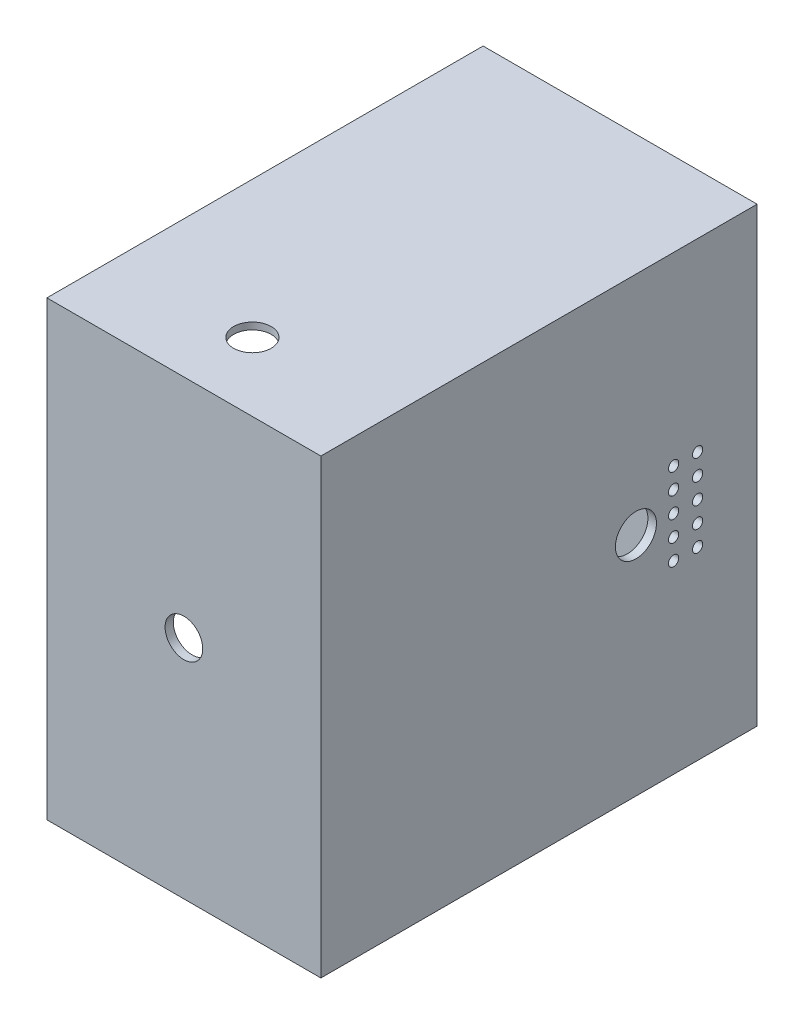
from build123d import *

# Parameters (mm, degrees)
S_BOX1_W        = 80
S_BOX1_H        = 132
BOSS_1_DEPTH    = 127.375
S_CYL2_R        = 3
BOSS_2_DEPTH    = 7.5
S_CYL3_R        = 3
BOSS_3_DEPTH    = 7.5
S_CYL4_R        = 3
BOSS_4_DEPTH    = 7.5
S_CYL5_R        = 3
BOSS_5_DEPTH    = 7.5
S_BOX6_W        = 27.6
S_BOX6_H        = 20.5
BOSS_6_DEPTH    = 17
S_BOX7_W        = 27.6
S_BOX7_H        = 20.5
BOSS_7_DEPTH    = 17
S_BOX8_W        = 27.6
S_BOX8_H        = 17
BOSS_8_DEPTH    = 22.5
S_CUT9_W        = 78.5
S_CUT9_H        = 127
POCKET_9_DEPTH  = 122.375
S_HOLE10_R      = 1.6
HOLE_10_DEPTH   = 2.7
S_HOLE11_R      = 1.6
HOLE_11_DEPTH   = 2.7
S_HOLE12_R      = 1.6
HOLE_12_DEPTH   = 2.7
S_HOLE13_R      = 1.6
HOLE_13_DEPTH   = 2.7
S_HOLE14_R      = 1.5
HOLE_14_DEPTH   = 2.7
S_HOLE15_R      = 1.5
HOLE_15_DEPTH   = 2.7
S_HOLE16_R      = 1.5
HOLE_16_DEPTH   = 2.7
S_HOLE17_R      = 1.5
HOLE_17_DEPTH   = 2.7
S_HOLE18_R      = 1.5
HOLE_18_DEPTH   = 2.7
S_HOLE19_R      = 1.5
HOLE_19_DEPTH   = 2.7
S_HOLE20_R      = 1.5
HOLE_20_DEPTH   = 2.7
S_HOLE21_R      = 1.5
HOLE_21_DEPTH   = 2.7
S_HOLE22_R      = 1.5
HOLE_22_DEPTH   = 2.7
S_HOLE23_R      = 1.5
HOLE_23_DEPTH   = 2.7
S_HOLE24_R      = 6
HOLE_24_DEPTH   = 2.7
S_HOLE25_R      = 1.1
HOLE_25_DEPTH   = 7.7
S_HOLE26_R      = 1.1
HOLE_26_DEPTH   = 7.7
S_HOLE27_R      = 1.1
HOLE_27_DEPTH   = 7.7
S_HOLE28_R      = 1.1
HOLE_28_DEPTH   = 7.7
S_CUT29_W       = 23.6
S_CUT29_H       = 20.6
POCKET_29_DEPTH = 13
S_HOLE30_R      = 5.5
HOLE_30_DEPTH   = 2.7
S_CUT31_W       = 23.6
S_CUT31_H       = 20.6
POCKET_31_DEPTH = 13
S_HOLE32_R      = 5.5
HOLE_32_DEPTH   = 2.7
S_CUT33_W       = 23.6
S_CUT33_H       = 13
POCKET_33_DEPTH = 22.2
S_HOLE34_R      = 5.5
HOLE_34_DEPTH   = 2.7


with BuildPart() as part:
    # S_box1 → Boss_1 (new body)
    with BuildSketch(Plane.XY.offset(68.625)):
        Rectangle(S_BOX1_W, S_BOX1_H)
    extrude(amount=BOSS_1_DEPTH)

    # S_cyl2 → Boss_2 (add)
    with BuildSketch(Plane(origin=(30.5, 0, 0), x_dir=(0, 0, -1), z_dir=(1, 0, 0))):
        with Locations((-115.5, -29)):
            Circle(S_CYL2_R)
    extrude(amount=BOSS_2_DEPTH)

    # S_cyl3 → Boss_3 (add)
    with BuildSketch(Plane(origin=(30.5, 0, 0), x_dir=(0, 0, -1), z_dir=(1, 0, 0))):
        with Locations((-164.5, -29)):
            Circle(S_CYL3_R)
    extrude(amount=BOSS_3_DEPTH)

    # S_cyl4 → Boss_4 (add)
    with BuildSketch(Plane(origin=(30.5, 0, 0), x_dir=(0, 0, -1), z_dir=(1, 0, 0))):
        with Locations((-115.5, 29)):
            Circle(S_CYL4_R)
    extrude(amount=BOSS_4_DEPTH)

    # S_cyl5 → Boss_5 (add)
    with BuildSketch(Plane(origin=(30.5, 0, 0), x_dir=(0, 0, -1), z_dir=(1, 0, 0))):
        with Locations((-164.5, 29)):
            Circle(S_CYL5_R)
    extrude(amount=BOSS_5_DEPTH)

    # S_box6 → Boss_6 (add)
    with BuildSketch(Plane.XY.offset(167.5)):
        with Locations((5.6, 53.75)):
            Rectangle(S_BOX6_W, S_BOX6_H)
    extrude(amount=BOSS_6_DEPTH)

    # S_box7 → Boss_7 (add)
    with BuildSketch(Plane.XY.offset(167.5)):
        with Locations((5.6, -53.75)):
            Rectangle(S_BOX7_W, S_BOX7_H)
    extrude(amount=BOSS_7_DEPTH)

    # S_box8 → Boss_8 (add)
    with BuildSketch(Plane.XY.offset(171.5)):
        with Locations((-5.6, 0)):
            Rectangle(S_BOX8_W, S_BOX8_H)
    extrude(amount=BOSS_8_DEPTH)

    # S_cut9 → Pocket_9 (cut)
    with BuildSketch(Plane.XY.offset(71.125)):
        with Locations((-1.75, 0)):
            Rectangle(S_CUT9_W, S_CUT9_H)
    extrude(amount=POCKET_9_DEPTH, mode=Mode.SUBTRACT)

    # S_hole10 → Hole_10 (cut)
    with BuildSketch(Plane.XY.offset(68.525)):
        with Locations((0, -25)):
            Circle(S_HOLE10_R)
    extrude(amount=HOLE_10_DEPTH, mode=Mode.SUBTRACT)

    # S_hole11 → Hole_11 (cut)
    with BuildSketch(Plane.XY.offset(68.525)):
        with Locations((0, 25)):
            Circle(S_HOLE11_R)
    extrude(amount=HOLE_11_DEPTH, mode=Mode.SUBTRACT)

    # S_hole12 → Hole_12 (cut)
    with BuildSketch(Plane.XY.offset(68.525)):
        with Locations((28, -25)):
            Circle(S_HOLE12_R)
    extrude(amount=HOLE_12_DEPTH, mode=Mode.SUBTRACT)

    # S_hole13 → Hole_13 (cut)
    with BuildSketch(Plane.XY.offset(68.525)):
        with Locations((28, 25)):
            Circle(S_HOLE13_R)
    extrude(amount=HOLE_13_DEPTH, mode=Mode.SUBTRACT)

    # S_hole14 → Hole_14 (cut)
    with BuildSketch(Plane(origin=(37.4, 0, 0), x_dir=(0, 0, -1), z_dir=(1, 0, 0))):
        with Locations((-86, -12)):
            Circle(S_HOLE14_R)
    extrude(amount=HOLE_14_DEPTH, mode=Mode.SUBTRACT)

    # S_hole15 → Hole_15 (cut)
    with BuildSketch(Plane(origin=(37.4, 0, 0), x_dir=(0, 0, -1), z_dir=(1, 0, 0))):
        with Locations((-93, -12)):
            Circle(S_HOLE15_R)
    extrude(amount=HOLE_15_DEPTH, mode=Mode.SUBTRACT)

    # S_hole16 → Hole_16 (cut)
    with BuildSketch(Plane(origin=(37.4, 0, 0), x_dir=(0, 0, -1), z_dir=(1, 0, 0))):
        with Locations((-86, -6)):
            Circle(S_HOLE16_R)
    extrude(amount=HOLE_16_DEPTH, mode=Mode.SUBTRACT)

    # S_hole17 → Hole_17 (cut)
    with BuildSketch(Plane(origin=(37.4, 0, 0), x_dir=(0, 0, -1), z_dir=(1, 0, 0))):
        with Locations((-93, -6)):
            Circle(S_HOLE17_R)
    extrude(amount=HOLE_17_DEPTH, mode=Mode.SUBTRACT)

    # S_hole18 → Hole_18 (cut)
    with BuildSketch(Plane(origin=(37.4, 0, 0), x_dir=(0, 0, -1), z_dir=(1, 0, 0))):
        with Locations((-86, 0)):
            Circle(S_HOLE18_R)
    extrude(amount=HOLE_18_DEPTH, mode=Mode.SUBTRACT)

    # S_hole19 → Hole_19 (cut)
    with BuildSketch(Plane(origin=(37.4, 0, 0), x_dir=(0, 0, -1), z_dir=(1, 0, 0))):
        with Locations((-93, 0)):
            Circle(S_HOLE19_R)
    extrude(amount=HOLE_19_DEPTH, mode=Mode.SUBTRACT)

    # S_hole20 → Hole_20 (cut)
    with BuildSketch(Plane(origin=(37.4, 0, 0), x_dir=(0, 0, -1), z_dir=(1, 0, 0))):
        with Locations((-86, 6)):
            Circle(S_HOLE20_R)
    extrude(amount=HOLE_20_DEPTH, mode=Mode.SUBTRACT)

    # S_hole21 → Hole_21 (cut)
    with BuildSketch(Plane(origin=(37.4, 0, 0), x_dir=(0, 0, -1), z_dir=(1, 0, 0))):
        with Locations((-93, 6)):
            Circle(S_HOLE21_R)
    extrude(amount=HOLE_21_DEPTH, mode=Mode.SUBTRACT)

    # S_hole22 → Hole_22 (cut)
    with BuildSketch(Plane(origin=(37.4, 0, 0), x_dir=(0, 0, -1), z_dir=(1, 0, 0))):
        with Locations((-86, 12)):
            Circle(S_HOLE22_R)
    extrude(amount=HOLE_22_DEPTH, mode=Mode.SUBTRACT)

    # S_hole23 → Hole_23 (cut)
    with BuildSketch(Plane(origin=(37.4, 0, 0), x_dir=(0, 0, -1), z_dir=(1, 0, 0))):
        with Locations((-93, 12)):
            Circle(S_HOLE23_R)
    extrude(amount=HOLE_23_DEPTH, mode=Mode.SUBTRACT)

    # S_hole24 → Hole_24 (cut)
    with BuildSketch(Plane(origin=(37.4, 0, 0), x_dir=(0, 0, -1), z_dir=(1, 0, 0))):
        with Locations((-104, 0)):
            Circle(S_HOLE24_R)
    extrude(amount=HOLE_24_DEPTH, mode=Mode.SUBTRACT)

    # S_hole25 → Hole_25 (cut)
    with BuildSketch(Plane(origin=(30.4, 0, 0), x_dir=(0, 0, -1), z_dir=(1, 0, 0))):
        with Locations((-115.5, -29)):
            Circle(S_HOLE25_R)
    extrude(amount=HOLE_25_DEPTH, mode=Mode.SUBTRACT)

    # S_hole26 → Hole_26 (cut)
    with BuildSketch(Plane(origin=(30.4, 0, 0), x_dir=(0, 0, -1), z_dir=(1, 0, 0))):
        with Locations((-164.5, -29)):
            Circle(S_HOLE26_R)
    extrude(amount=HOLE_26_DEPTH, mode=Mode.SUBTRACT)

    # S_hole27 → Hole_27 (cut)
    with BuildSketch(Plane(origin=(30.4, 0, 0), x_dir=(0, 0, -1), z_dir=(1, 0, 0))):
        with Locations((-115.5, 29)):
            Circle(S_HOLE27_R)
    extrude(amount=HOLE_27_DEPTH, mode=Mode.SUBTRACT)

    # S_hole28 → Hole_28 (cut)
    with BuildSketch(Plane(origin=(30.4, 0, 0), x_dir=(0, 0, -1), z_dir=(1, 0, 0))):
        with Locations((-164.5, 29)):
            Circle(S_HOLE28_R)
    extrude(amount=HOLE_28_DEPTH, mode=Mode.SUBTRACT)

    # S_cut29 → Pocket_29 (cut)
    with BuildSketch(Plane.XY.offset(169.5)):
        with Locations((5.6, 53.7)):
            Rectangle(S_CUT29_W, S_CUT29_H)
    extrude(amount=POCKET_29_DEPTH, mode=Mode.SUBTRACT)

    # S_hole30 → Hole_30 (cut)
    with BuildSketch(Plane(origin=(0, 63.4, 0), x_dir=(1, 0, 0), z_dir=(0, 1, 0))):
        with Locations((0, -176)):
            Circle(S_HOLE30_R)
    extrude(amount=HOLE_30_DEPTH, mode=Mode.SUBTRACT)

    # S_cut31 → Pocket_31 (cut)
    with BuildSketch(Plane.XY.offset(169.5)):
        with Locations((5.6, -53.7)):
            Rectangle(S_CUT31_W, S_CUT31_H)
    extrude(amount=POCKET_31_DEPTH, mode=Mode.SUBTRACT)

    # S_hole32 → Hole_32 (cut)
    with BuildSketch(Plane(origin=(0, -66.1, 0), x_dir=(1, 0, 0), z_dir=(0, 1, 0))):
        with Locations((0, -176)):
            Circle(S_HOLE32_R)
    extrude(amount=HOLE_32_DEPTH, mode=Mode.SUBTRACT)

    # S_cut33 → Pocket_33 (cut)
    with BuildSketch(Plane.XY.offset(171.4)):
        with Locations((-5.6, 0)):
            Rectangle(S_CUT33_W, S_CUT33_H)
    extrude(amount=POCKET_33_DEPTH, mode=Mode.SUBTRACT)

    # S_hole34 → Hole_34 (cut)
    with BuildSketch(Plane.XY.offset(193.4)):
        Circle(S_HOLE34_R)
    extrude(amount=HOLE_34_DEPTH, mode=Mode.SUBTRACT)


solid = part.part
